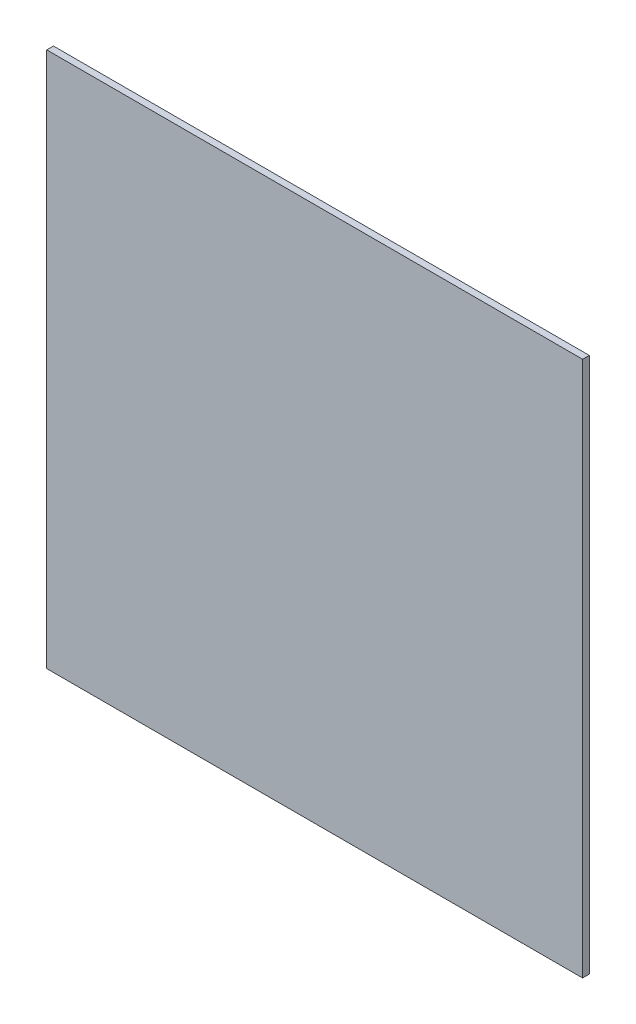
from build123d import *

# Parameters (mm, degrees)
SKIZZE1_W                       = 800
SKIZZE1_H                       = 800
AUFSATZ_LINEAR_AUSTRAGEN1_DEPTH = 10


with BuildPart() as part:
    # Skizze1 → Aufsatz-Linear austragen1 (new body)
    with BuildSketch(Plane.XY):
        Rectangle(SKIZZE1_W, SKIZZE1_H)
    extrude(amount=AUFSATZ_LINEAR_AUSTRAGEN1_DEPTH)


solid = part.part
